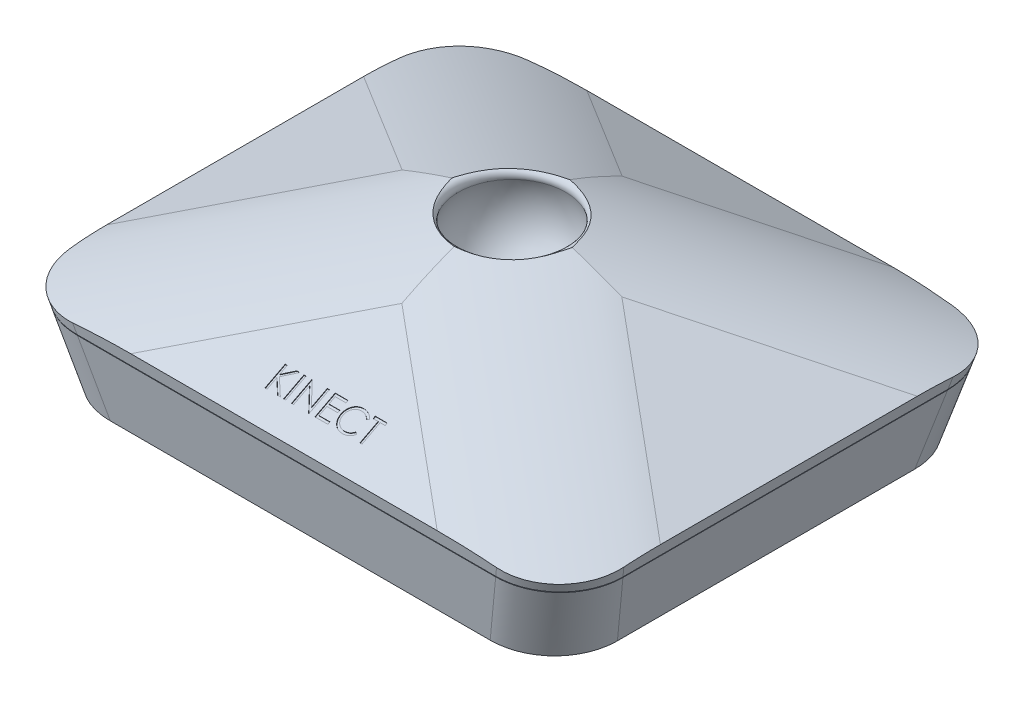
from build123d import *

# Parameters (mm, degrees)
SKETCH1_W               = 85
SKETCH1_H               = 70
BOSS_EXTRUDE1_DEPTH     = 26
CUT_EXTRUDE1_DEPTH      = 86.92002095
CUT_EXTRUDE2_DEPTH      = 86.92002095
CUT_EXTRUDE3_DEPTH      = 61.887190771
CUT_EXTRUDE3_DEPTH_BACK = 61.887190771
CUT_EXTRUDE4_DEPTH      = 61.887190771
CUT_EXTRUDE4_DEPTH_BACK = 61.887190771
SKETCH7_W               = 5
SKETCH7_H               = 5
CUT_EXTRUDE5_DEPTH      = 5
FILLET1_R               = 40
FILLET2_R               = 10
FILLET3_R               = 1
SKETCH9_W               = 0.314102565
SKETCH9_H               = 3.5
CUT_EXTRUDE6_DEPTH      = 0.1
BOSS_EXTRUDE2_DEPTH     = 0.5
CUT_EXTRUDE7_START      = 35
SKETCH11_W              = 95
SKETCH11_H              = 0.1
CUT_EXTRUDE7_DEPTH      = 10
CUT_EXTRUDE8_START      = 42.5
SKETCH12_W              = 50
SKETCH12_H              = 0.1
CUT_EXTRUDE8_DEPTH      = 1
SKETCH13_R              = 2.5
SKETCH13_W              = 5
SKETCH13_H              = 7.5
CUT_EXTRUDE9_DEPTH      = 4
CUT_EXTRUDE10_DEPTH     = 0.5


with BuildPart() as part:
    # Sketch1 → Boss-Extrude1 (new body)
    with BuildSketch(Plane(origin=(0, 0, 0), x_dir=(1, 0, 0), z_dir=(0, 1, 0))):
        Rectangle(SKETCH1_W, SKETCH1_H)
    extrude(amount=BOSS_EXTRUDE1_DEPTH)

    # Sketch2 → Cut-Extrude1 (cut, through all)
    with BuildSketch(Plane.XY.offset(35)):
        Polygon((-39, 0), (-42.5, 0), (-42.5, 13), align=None)
        Polygon((39, 0), (42.5, 0), (42.5, 13), align=None)
    extrude(amount=-CUT_EXTRUDE1_DEPTH, mode=Mode.SUBTRACT)

    # Sketch3 → Cut-Extrude2 (cut, through all)
    with BuildSketch(Plane.XY.offset(35)):
        Polygon((-10, 26), (-42.5, 13), (-42.5, 26), align=None)
        Polygon((10, 26), (42.5, 13), (42.5, 26), align=None)
    extrude(amount=-CUT_EXTRUDE2_DEPTH, mode=Mode.SUBTRACT)

    # Sketch4 → Cut-Extrude3 (cut, two sides: drawn at the far end of the back side and taken through both)
    with BuildSketch(Plane(origin=(0, 0, 0), x_dir=(0, 0, -1), z_dir=(1, 0, 0)).offset(-CUT_EXTRUDE3_DEPTH_BACK)):
        Polygon((32.5, 0), (35, 13), (35, 0), align=None)
        Polygon((-32.5, 0), (-35, 13), (-35, 0), align=None)
    extrude(amount=CUT_EXTRUDE3_DEPTH + CUT_EXTRUDE3_DEPTH_BACK, mode=Mode.SUBTRACT)

    # Sketch5 → Cut-Extrude4 (cut, two sides: drawn at the far end of the back side and taken through both)
    with BuildSketch(Plane(origin=(0, 0, 0), x_dir=(0, 0, -1), z_dir=(1, 0, 0)).offset(-CUT_EXTRUDE4_DEPTH_BACK)):
        Polygon((10, 26), (35, 13), (35, 26), align=None)
        Polygon((-10, 26), (-35, 13), (-35, 26), align=None)
    extrude(amount=CUT_EXTRUDE4_DEPTH + CUT_EXTRUDE4_DEPTH_BACK, mode=Mode.SUBTRACT)

    # Sketch7 → Cut-Extrude5 (cut)
    with BuildSketch(Plane(origin=(0, 26, 0), x_dir=(1, 0, 0), z_dir=(0, 1, 0))):
        Rectangle(SKETCH7_W, SKETCH7_H)
    extrude(amount=-CUT_EXTRUDE5_DEPTH, mode=Mode.SUBTRACT)

    # Sketch8 → Cut-Revolve3 (revolve, cut)
    with BuildSketch(Plane(origin=(0, 21, 0), x_dir=(1, 0, 0), z_dir=(0, 1, 0))):
        with BuildLine():
            Line((-9, 0), (9, 0))
            ThreePointArc((9, 0), (0, 9), (-9, 0))
        make_face()
    revolve(axis=Axis((-17.101382006, 21, 0), (1, 0, 0)), mode=Mode.SUBTRACT)

    # Fillet1
    # the kernel refuses this fillet: 40 mm, written as the material it takes off along each edge
    with BuildSketch(Plane(origin=(-13.487478294, 35.394991318, 8.067290995), x_dir=(-0.6550810625309597, -0.34857902886565556, -0.6703442862801066), z_dir=(0.755558602302501, -0.30222344092100045, -0.5811989248480778)), Plane(origin=(-13.487478294, 35.394991318, -8.067290995), x_dir=(0.539629654489014, -0.2158518617956056, -0.8137615189694326), z_dir=(0.755558602302501, -0.3022234409210005, 0.581198924848078))) as fillet1_piece_1:
        with BuildLine():
            CenterArc((FILLET1_R * 0.310862429761, -FILLET1_R), FILLET1_R, 90, 34.537012927)
            Line((-FILLET1_R * 0.256076072353, -FILLET1_R * 0.176239880292), (0, 0))
            Line((0, 0), (FILLET1_R * 0.310862429761, 0))
        make_face()
    extrude(amount=105.18701838, mode=Mode.SUBTRACT)
    with BuildSketch(Plane(origin=(13.487478294, 35.394991318, 8.067290995), x_dir=(0.6550810625309597, -0.34857902886565556, -0.6703442862801066), z_dir=(-0.755558602302501, -0.30222344092100045, -0.5811989248480778)), Plane(origin=(13.487478294, 35.394991318, -8.067290995), x_dir=(-0.539629654489014, -0.2158518617956056, -0.8137615189694326), z_dir=(-0.755558602302501, -0.3022234409210005, 0.581198924848078))) as fillet1_piece_2:
        with BuildLine():
            CenterArc((FILLET1_R * 0.310862429761, FILLET1_R), FILLET1_R, 235.462987073, 34.537012927)
            Line((-FILLET1_R * 0.256076072353, FILLET1_R * 0.176239880292), (0, 0))
            Line((0, 0), (FILLET1_R * 0.310862429761, 0))
        make_face()
    extrude(amount=105.18701838, mode=Mode.SUBTRACT)

    # Fillet2
    fillet2_edges = [part.edges().sort_by_distance(p)[0] for p in [
        (-40.507776449, 5.600312524, -33.576983178),
        (40.507776449, 5.600312524, -33.576983178),
        (40.507776449, 5.600312524, 33.576983178),
        (-40.507776449, 5.600312524, 33.576983178),
    ]]
    fillet(fillet2_edges, radius=FILLET2_R)

    # Fillet3
    # the kernel refuses this fillet: 1 mm, written as the material it takes off along each edge
    with BuildSketch(Plane(origin=(0, 26, 0), x_dir=(0, 0, -1), z_dir=(-1, 0, 0))) as fillet3_piece_1:
        with BuildLine():
            CenterArc((9.16515139, 1), FILLET3_R, 156.421821522, 113.578178478)
            ThreePointArc((8.248636251, 1.4), (7.897060894, 0.683006921), (7.483314774, 0))
            Line((7.483314774, 0), (9.16515139, 0))
        make_face()
    revolve(axis=Axis((0, 26, 0), (0, -1, 0)), mode=Mode.SUBTRACT)

    # Sketch9 → Cut-Extrude6 (cut)
    with BuildSketch(Plane(origin=(0, 24.559193955, 12.770780856), x_dir=(1, 0, 0), z_dir=(0, 0.8872168012345952, 0.4613527366419895))):
        Polygon((-6.695257857, -17.294603055), (-6.381155293, -17.294603055), (-6.381155293, -18.627435587), (-4.922120838, -17.294603055), (-4.474104011, -17.294603055), (-6.193955774, -18.865115875), (-4.339488627, -20.794603055), (-4.758058338, -20.794603055), (-6.381155293, -19.105600651), (-6.381155293, -20.794603055), (-6.695257857, -20.794603055), align=None)
        with Locations((-3.666411704, -19.044603055)):
            Rectangle(SKETCH9_W, SKETCH9_H)
        Polygon((-2.611924524, -20.794603055), (-2.611924524, -17.294603055), (-2.546019075, -17.294603055), (-0.233719396, -20.049310587), (-0.233719396, -17.294603055), (0.080383168, -17.294603055), (0.080383168, -20.794603055), (0.008868745, -20.794603055), (-2.29782196, -18.046205619), (-2.29782196, -20.794603055), align=None)
        Polygon((0.977819066, -17.294603055), (2.95217804, -17.294603055), (2.95217804, -17.653577414), (1.29192163, -17.653577414), (1.29192163, -18.730500491), (2.95217804, -18.730500491), (2.95217804, -19.08947485), (1.29192163, -19.08947485), (1.29192163, -20.435628696), (2.95217804, -20.435628696), (2.95217804, -20.794603055), (0.977819066, -20.794603055), align=None)
        with BuildLine():
            Line((6.811152399, -17.936830619), (6.536312655, -18.147167157))
            add(Edge.make_bspline(
                [(6.536312655, -18.147167157), (6.516706767, -18.123801188), (6.47775932, -18.077384272), (6.415100118, -18.012204727), (6.349798475, -17.951139466), (6.281879354, -17.893897586), (6.210120234, -17.842480821), (6.136259435, -17.794209718), (6.05906139, -17.75094198), (5.952309656, -17.698478994), (5.812661807, -17.643732839), (5.636866968, -17.597829607), (5.45335587, -17.568608432), (5.32815827, -17.56544359), (5.26447772, -17.563833824)],
                knots=[0, 0, 0, 0, 0.757959112, 1.505699292, 2.245454638, 2.979532153, 3.711538275, 4.438200793, 5.171680507, 5.909471876, 7.393775596, 8.890124382, 10.418191784, 12, 12, 12, 12], degree=3))
            add(Edge.make_bspline(
                [(5.26447772, -17.563833824), (5.22939442, -17.564237787), (5.159553428, -17.565041963), (5.055904954, -17.575651088), (4.954191903, -17.590562298), (4.854480437, -17.612687621), (4.756897478, -17.64066024), (4.660805076, -17.674085654), (4.567594476, -17.715440494), (4.475976238, -17.761148754), (4.388197027, -17.812776199), (4.305141979, -17.86908955), (4.227114011, -17.929458647), (4.154051399, -17.994109753), (4.085879451, -18.062751714), (4.02309214, -18.136116055), (3.96590673, -18.213968229), (3.913189705, -18.295281636), (3.865976972, -18.379819428), (3.826447092, -18.467894498), (3.79144197, -18.557998601), (3.763742727, -18.651149762), (3.74181821, -18.746692528), (3.726690547, -18.844883316), (3.716202076, -18.945516996), (3.715401899, -19.013726308), (3.714998553, -19.048108664)],
                knots=[0, 0, 0, 0, 1.054917814, 2.100044995, 3.131103042, 4.146048494, 5.169673617, 6.183595914, 7.203665975, 8.234915748, 9.262203917, 10.264457458, 11.251630812, 12.227803204, 13.197192746, 14.159520551, 15.12972552, 16.100847026, 17.073214652, 18.039054194, 19.002613845, 19.979014051, 20.95965708, 21.949030935, 22.966165397, 24, 24, 24, 24], degree=3))
            add(Edge.make_bspline(
                [(3.714998553, -19.048108664), (3.716260372, -19.099839984), (3.718737786, -19.201407569), (3.74078612, -19.350178179), (3.774291212, -19.492698853), (3.824506788, -19.628078695), (3.886425839, -19.757987053), (3.964666451, -19.880225907), (4.055282988, -19.996642471), (4.159557407, -20.104485419), (4.273963223, -20.202999144), (4.396711135, -20.289749726), (4.527495423, -20.362064608), (4.664872053, -20.422240555), (4.809898167, -20.468497282), (4.962312969, -20.501061406), (5.121784965, -20.522303586), (5.230754364, -20.524337275), (5.286212495, -20.525372286)],
                knots=[0, 0, 0, 0, 1.029171465, 2.020641659, 2.987623507, 3.938342917, 4.889210282, 5.84687017, 6.821220943, 7.821438502, 8.827599549, 9.822697543, 10.807740252, 11.797342354, 12.80366471, 13.83203677, 14.896651826, 16, 16, 16, 16], degree=3))
            add(Edge.make_bspline(
                [(5.286212495, -20.525372286), (5.347315184, -20.523683506), (5.467579893, -20.520359583), (5.643947919, -20.492200334), (5.812783685, -20.446542416), (5.974096272, -20.382644494), (6.127430918, -20.299579206), (6.273027578, -20.198881329), (6.411009149, -20.079592996), (6.493980431, -19.988509868), (6.536312655, -19.942038952)],
                knots=[0, 0, 0, 0, 1.028121516, 2.023589091, 2.998037872, 3.967518031, 4.937445131, 5.927275754, 6.942489185, 8, 8, 8, 8], degree=3))
            Line((6.536312655, -19.942038952), (6.811152399, -20.150272125))
            add(Edge.make_bspline(
                [(6.811152399, -20.150272125), (6.789034289, -20.178810577), (6.744904014, -20.235750784), (6.673445997, -20.316022493), (6.5981687, -20.391526529), (6.51851299, -20.46165415), (6.435395198, -20.527808616), (6.347322886, -20.588110447), (6.255453853, -20.643401331), (6.160099374, -20.694028256), (6.061360761, -20.738945503), (5.959356326, -20.777399271), (5.854525751, -20.81052416), (5.746864242, -20.837776097), (5.636148486, -20.859047181), (5.522778012, -20.873266856), (5.406508136, -20.88300877), (5.328066715, -20.883896686), (5.288315861, -20.884346645)],
                knots=[0, 0, 0, 0, 0.986787822, 1.968848986, 2.935600012, 3.899624008, 4.868462664, 5.837806735, 6.815139263, 7.798259679, 8.787526145, 9.778297419, 10.776456485, 11.791383307, 12.812564526, 13.85620153, 14.913611965, 16, 16, 16, 16], degree=3))
            add(Edge.make_bspline(
                [(5.288315861, -20.884346645), (5.250672194, -20.884084652), (5.176236503, -20.883566594), (5.066337752, -20.875174427), (4.959348171, -20.86372469), (4.855573545, -20.846484559), (4.75444757, -20.826140219), (4.656886986, -20.798868962), (4.561931775, -20.768319796), (4.469963435, -20.732414809), (4.380903735, -20.691898626), (4.295039923, -20.646107067), (4.212411491, -20.595425203), (4.13220607, -20.540970192), (4.055608486, -20.48099289), (3.981954961, -20.416326256), (3.910832485, -20.347188245), (3.8668298, -20.297333392), (3.844706085, -20.272267318)],
                knots=[0, 0, 0, 0, 1.114604814, 2.203992996, 3.262667896, 4.300477797, 5.318619304, 6.316056647, 7.298880507, 8.271930387, 9.238335007, 10.195173496, 11.151986948, 12.108099108, 13.064862484, 14.031167946, 15.010108607, 16, 16, 16, 16], degree=3))
            add(Edge.make_bspline(
                [(3.844706085, -20.272267318), (3.809270441, -20.228726129), (3.738826965, -20.142169418), (3.648701281, -20.001883437), (3.571553726, -19.855415228), (3.509177805, -19.701995299), (3.460415072, -19.541967912), (3.426633877, -19.375252398), (3.404682272, -19.202004456), (3.402171984, -19.084167667), (3.400895989, -19.024270523)],
                knots=[0, 0, 0, 0, 0.994628077, 1.977248131, 2.950237994, 3.925870899, 4.908910175, 5.911660606, 6.938484602, 8, 8, 8, 8], degree=3))
            add(Edge.make_bspline(
                [(3.400895989, -19.024270523), (3.402451182, -18.961315069), (3.405510929, -18.837454145), (3.431506724, -18.655680191), (3.47332552, -18.481528793), (3.532722409, -18.315325048), (3.60802776, -18.156194768), (3.701054374, -18.005353563), (3.810721516, -17.861836763), (3.936169084, -17.727822012), (4.073736419, -17.605282659), (4.221055233, -17.497476456), (4.37783718, -17.40775894), (4.542355032, -17.332762777), (4.715840713, -17.275118314), (4.897924082, -17.234765127), (5.088262997, -17.209648011), (5.218125423, -17.206472803), (5.28410913, -17.204859465)],
                knots=[0, 0, 0, 0, 1.032925535, 2.032216505, 3.007276963, 3.968222605, 4.92396291, 5.891752235, 6.871517503, 7.883894988, 8.900124299, 9.891468569, 10.874487609, 11.85992873, 12.854644235, 13.869047385, 14.917252991, 16, 16, 16, 16], degree=3))
            add(Edge.make_bspline(
                [(5.28410913, -17.204859465), (5.324323602, -17.205341603), (5.403924099, -17.206295947), (5.521676751, -17.215602089), (5.636319078, -17.231115696), (5.74793006, -17.252231765), (5.857052677, -17.278439087), (5.962852918, -17.312579385), (6.065951604, -17.351615917), (6.165698513, -17.396574383), (6.261615063, -17.447041124), (6.353671381, -17.502456747), (6.44113624, -17.562752553), (6.524625088, -17.627415728), (6.602741299, -17.697814288), (6.677702778, -17.772011884), (6.746963856, -17.852145708), (6.789717051, -17.908550642), (6.811152399, -17.936830619)],
                knots=[0, 0, 0, 0, 1.096760587, 2.17092713, 3.219439832, 4.250915756, 5.268269357, 6.278326846, 7.281116186, 8.274029601, 9.260640565, 10.235837813, 11.203064059, 12.156899882, 13.114053108, 14.069676657, 15.032185724, 16, 16, 16, 16], degree=3))
        make_face()
        Polygon((7.125254963, -17.653577414), (7.125254963, -17.294603055), (8.964998553, -17.294603055), (8.964998553, -17.653577414), (8.20217804, -17.653577414), (8.20217804, -20.794603055), (7.888075476, -20.794603055), (7.888075476, -17.653577414), align=None)
    extrude(amount=-CUT_EXTRUDE6_DEPTH, mode=Mode.SUBTRACT)

    # Sketch10 → Boss-Extrude2 (add)
    with BuildSketch(Plane.XZ):
        with BuildLine():
            Line((-29.152349123, 31.803152106), (29.152349123, 31.803152106))
            ThreePointArc((29.152349123, 31.803152106), (35.364432178, 29.031276619), (38.130749501, 22.816716453))
            Line((38.130749501, 22.816716453), (38.130749501, -22.816716453))
            ThreePointArc((38.130749501, -22.816716453), (35.364432178, -29.031276619), (29.152349123, -31.803152106))
            Line((29.152349123, -31.803152106), (-29.152349123, -31.803152106))
            ThreePointArc((-29.152349123, -31.803152106), (-35.364432178, -29.031276619), (-38.130749501, -22.816716453))
            Line((-38.130749501, -22.816716453), (-38.130749501, 22.816716453))
            ThreePointArc((-38.130749501, 22.816716453), (-35.364432178, 29.031276619), (-29.152349123, 31.803152106))
        make_face()
    extrude(amount=BOSS_EXTRUDE2_DEPTH)

    # Sketch11 → Cut-Extrude7 (cut)
    with BuildSketch(Plane.XY.offset(CUT_EXTRUDE7_START)):
        with Locations((0, 11)):
            Rectangle(SKETCH11_W, SKETCH11_H)
    cut_extrude7 = extrude(amount=-CUT_EXTRUDE7_DEPTH, mode=Mode.SUBTRACT)

    # Mirror1: Cut-Extrude7 across plane
    add(cut_extrude7.mirror(Plane.XY), mode=Mode.SUBTRACT)

    # Sketch12 → Cut-Extrude8 (cut)
    with BuildSketch(Plane(origin=(0, 0, 0), x_dir=(0, 0, -1), z_dir=(1, 0, 0)).offset(CUT_EXTRUDE8_START)):
        with Locations((0, 11)):
            Rectangle(SKETCH12_W, SKETCH12_H)
    cut_extrude8 = extrude(amount=-CUT_EXTRUDE8_DEPTH, mode=Mode.SUBTRACT)

    # Mirror2: Cut-Extrude8 across plane
    add(cut_extrude8.mirror(Plane(origin=(0, 0, 0), x_dir=(0, 0, 1), z_dir=(1, 0, 0))), mode=Mode.SUBTRACT)

    # Sketch13 → Cut-Extrude9 (cut)
    with BuildSketch(Plane.XZ.offset(0.5)):
        with Locations(Location((-33.75, 10, 0), (0, 0, 270))):
            Circle(SKETCH13_R)
        with Locations(Location((-33.75, -10, 0), (0, 0, 270))):
            Circle(SKETCH13_R)
        with Locations((-33.75, 0)):
            Rectangle(SKETCH13_W, SKETCH13_H)
    cut_extrude9 = extrude(amount=-CUT_EXTRUDE9_DEPTH, mode=Mode.SUBTRACT)

    # Mirror3: Cut-Extrude9 across plane
    add(cut_extrude9.mirror(Plane(origin=(0, 0, 0), x_dir=(0, 0, 1), z_dir=(1, 0, 0))), mode=Mode.SUBTRACT)

    # Sketch14 → Cut-Extrude10 (cut)
    with BuildSketch(Plane.XZ.offset(0.5)):
        with BuildLine():
            Line((-30.75002446, -10), (-30.75002446, 10))
            ThreePointArc((-30.75002446, 10), (-31.467937712, 11.947317374), (-33.278075043, 12.96262385))
            Line((-33.278075043, 12.96262385), (-38.130749501, 13.75))
            Line((-38.130749501, 13.75), (-38.130749501, -13.75))
            Line((-38.130749501, -13.75), (-33.269526851, -12.961249532))
            ThreePointArc((-33.269526851, -12.961249532), (-31.465130099, -11.944022318), (-30.75002446, -10))
        make_face()
    cut_extrude10 = extrude(amount=-CUT_EXTRUDE10_DEPTH, mode=Mode.SUBTRACT)

    # Mirror4: Cut-Extrude10 across plane
    add(cut_extrude10.mirror(Plane(origin=(0, 0, 0), x_dir=(0, 0, 1), z_dir=(1, 0, 0))), mode=Mode.SUBTRACT)


solid = part.part
